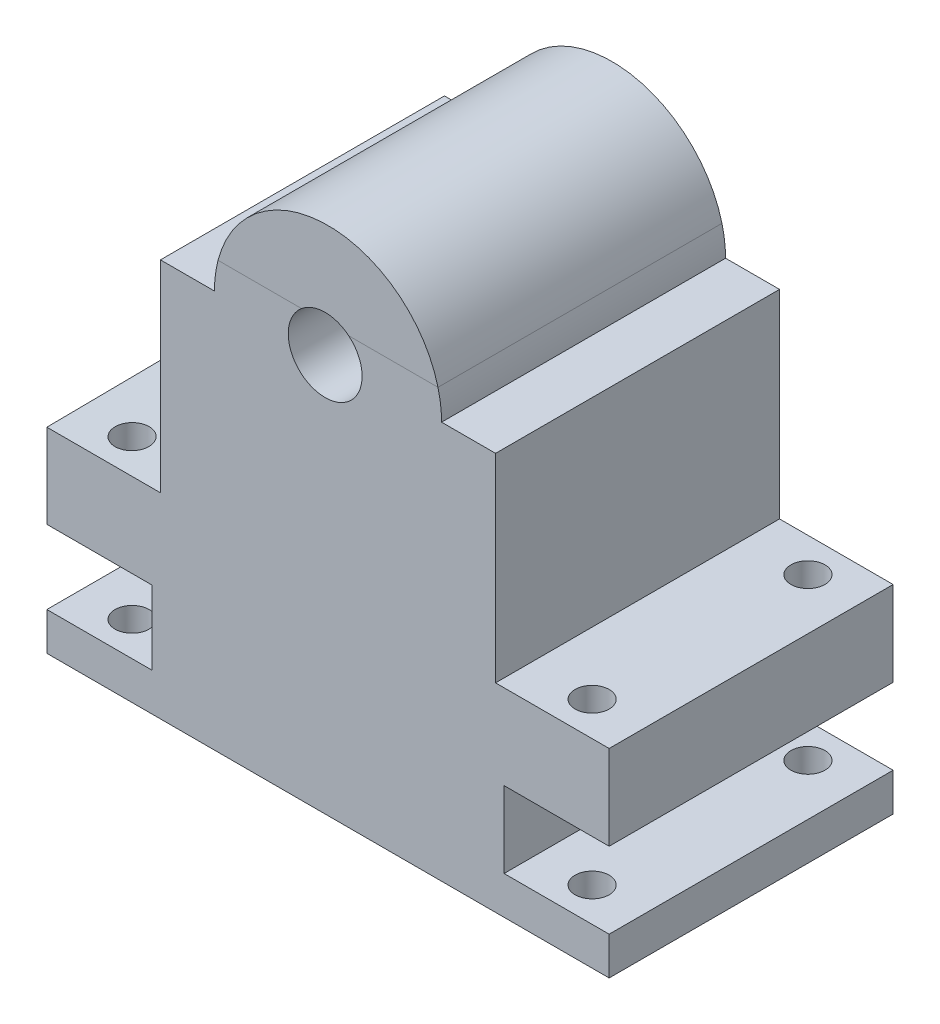
from build123d import *

# Parameters (mm, degrees)
BOSS_EXTRU_1_DEPTH       = 500
ESQUISSE2_W              = 990
ESQUISSE2_H              = 500
BOSS_EXTRU_2_DEPTH       = 250
ENL_V_MAT_EXTRU_6_DEPTH  = 200
ESQUISSE15_W             = 500
ESQUISSE15_H             = 350
ENL_V_MAT_EXTRU_7_DEPTH  = 200
ESQUISSE16_W             = 500
ESQUISSE16_H             = 134.041314403
ENL_V_MAT_EXTRU_8_DEPTH  = 185
ESQUISSE17_W             = 500
ESQUISSE17_H             = 129.824071981
ENL_V_MAT_EXTRU_9_DEPTH  = 185
ESQUISSE18_R             = 30
ENL_V_MAT_EXTRU_10_DEPTH = 450
ESQUISSE19_R             = 65
ENL_V_MAT_EXTRU_11_DEPTH = 500


with BuildPart() as part:
    # Esquisse1 → Boss.-Extru.1 (new body)
    with BuildSketch(Plane.XY):
        with BuildLine():
            Line((0, 0), (990, 0))
            Line((990, 0), (990, 450))
            Line((990, 450), (695, 450))
            ThreePointArc((695, 450), (495, 650), (295, 450))
            Line((295, 450), (0, 450))
            Line((0, 450), (0, 0))
        make_face()
    extrude(amount=BOSS_EXTRU_1_DEPTH)

    # Esquisse2 → Boss.-Extru.2 (add)
    with BuildSketch(Plane.XZ):
        with Locations((495, 250)):
            Rectangle(ESQUISSE2_W, ESQUISSE2_H)
    extrude(amount=BOSS_EXTRU_2_DEPTH)


with BuildPart() as body_2:
    # Fractionner2: the piece on the far side of the plane
    add(part.part)
    split(bisect_by=Plane(origin=(0, 500, 0), x_dir=(0, 0, -1), z_dir=(0, -1, 0)), keep=Keep.BOTTOM)


with BuildPart() as part_1:
    add(part.part)

    # Fractionner2
    split(bisect_by=Plane(origin=(0, 500, 0), x_dir=(0, 0, -1), z_dir=(0, -1, 0)), keep=Keep.TOP)

    # Esquisse14 → Enlèv. mat.-Extru.6 (cut)
    with BuildSketch(Plane.ZY):
        Polygon((500, 94.871649535), (0, 100), (0, 450), (500, 450), align=None)
    extrude(amount=-ENL_V_MAT_EXTRU_6_DEPTH, mode=Mode.SUBTRACT)

    # Esquisse15 → Enlèv. mat.-Extru.7 (cut)
    with BuildSketch(Plane(origin=(990, 0, 0), x_dir=(0, 0, -1), z_dir=(1, 0, 0))):
        with Locations((-250, 275)):
            Rectangle(ESQUISSE15_W, ESQUISSE15_H)
    extrude(amount=-ENL_V_MAT_EXTRU_7_DEPTH, mode=Mode.SUBTRACT)

    # Esquisse16 → Enlèv. mat.-Extru.8 (cut)
    with BuildSketch(Plane(origin=(990, 0, 0), x_dir=(0, 0, -1), z_dir=(1, 0, 0))):
        with Locations((-250, -116.14971871)):
            Rectangle(ESQUISSE16_W, ESQUISSE16_H)
    extrude(amount=-ENL_V_MAT_EXTRU_8_DEPTH, mode=Mode.SUBTRACT)

    # Esquisse17 → Enlèv. mat.-Extru.9 (cut)
    with BuildSketch(Plane.ZY):
        with Locations((250, -118.202021533)):
            Rectangle(ESQUISSE17_W, ESQUISSE17_H)
    extrude(amount=-ENL_V_MAT_EXTRU_9_DEPTH, mode=Mode.SUBTRACT)

    # Esquisse18 → Enlèv. mat.-Extru.10 (cut)
    with BuildSketch(Plane(origin=(0, 100, 0), x_dir=(1, 0, 0), z_dir=(0, 1, 0))):
        with Locations((900, -440)):
            Circle(ESQUISSE18_R)
        with Locations((900, -60)):
            Circle(ESQUISSE18_R)
        with Locations((90, -440)):
            Circle(ESQUISSE18_R)
        with Locations((90, -60)):
            Circle(ESQUISSE18_R)
    extrude(amount=-ENL_V_MAT_EXTRU_10_DEPTH, mode=Mode.SUBTRACT)


with BuildPart() as enl_v_mat_extru_11_tool:
    # Esquisse19 → Enlèv. mat.-Extru.11 (new body)
    with BuildSketch(Plane(origin=(0, 0, 0), x_dir=(-1, 0, 0), z_dir=(0, 0, -1))):
        with Locations((-490, 450)):
            Circle(ESQUISSE19_R)
    extrude(amount=-ENL_V_MAT_EXTRU_11_DEPTH)


with BuildPart() as part_2:
    add(part_1.part)

    # Enlèv. mat.-Extru.11: cut by enl_v_mat_extru_11_tool
    add(enl_v_mat_extru_11_tool.part, mode=Mode.SUBTRACT)


with BuildPart() as body_2_1:
    add(body_2.part)

    # Enlèv. mat.-Extru.11: cut by enl_v_mat_extru_11_tool
    add(enl_v_mat_extru_11_tool.part, mode=Mode.SUBTRACT)


solid = Compound([part_2.part, body_2_1.part])
